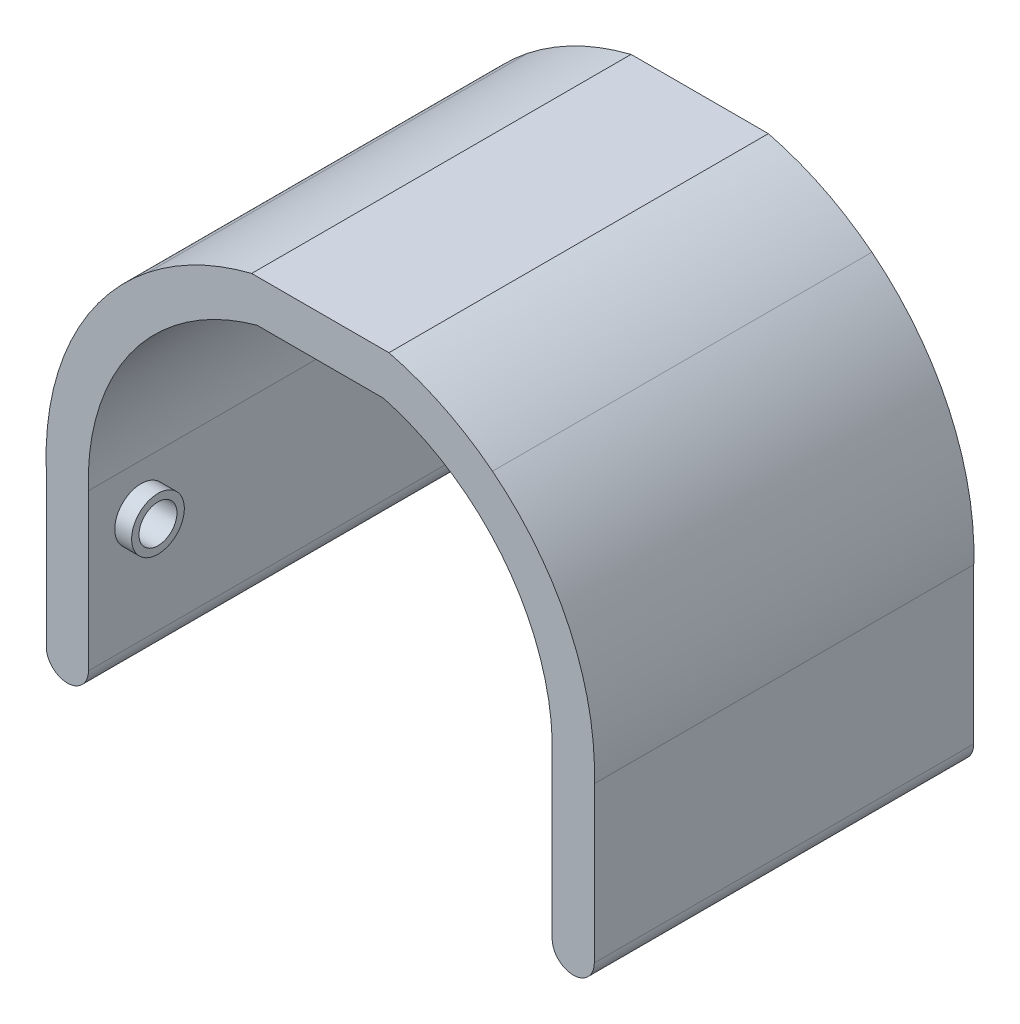
from build123d import *

# Parameters (mm, degrees)
SKETCH1_W                           = 50
SKETCH1_H                           = 50
BOSS_EXTRUDE1_DEPTH                 = 60
CUT_EXTRUDE1_DEPTH                  = 60
CUT_EXTRUDE2_START                  = -60
CUT_EXTRUDE2_DEPTH                  = 60
SKETCH5_OUTSIDE_W                   = 70.548
SKETCH5_OUTSIDE_H                   = 70.548
CUT_EXTRUDE3_DEPTH                  = 10
CUT_EXTRUDE4_DEPTH                  = 10
FILLET1_R                           = 1
SKETCH7_R                           = 2
BOSS_EXTRUDE2_DEPTH                 = 2
BOSS_EXTRUDE3_START                 = 2
SKETCH8_R                           = 2
BOSS_EXTRUDE3_DEPTH                 = 2
SKETCH9_R                           = 2.25
CUT_EXTRUDE5_DEPTH                  = 2
CUT_EXTRUDE6_START                  = -2
SKETCH10_R                          = 2.25
CUT_EXTRUDE6_DEPTH                  = 2
FILLET2_R                           = 1
CUT_EXTRUDE7_REACH                  = 71.642
CUT_EXTRUDE7_END_RADIUS             = 25
CUT_EXTRUDE7_DIRECTION_2_REACH      = 71.642
CUT_EXTRUDE7_DIRECTION_2_END_RADIUS = 25
BOSS_EXTRUDE4_DEPTH                 = 35
BOSS_EXTRUDE4_DEPTH_BACK            = 10
SKETCH14_R                          = 2
BOSS_EXTRUDE5_DEPTH                 = 0.1
SKETCH15_R                          = 3
SKETCH15_R_2                        = 2.25
BOSS_EXTRUDE6_DEPTH                 = 7
SKETCH16_R                          = 2.25
CUT_EXTRUDE8_DEPTH                  = 2
SKETCH17_W                          = 10
SKETCH17_H                          = 10
CUT_EXTRUDE9_DEPTH                  = 29.758852585
SKETCH18_W                          = 10
SKETCH18_H                          = 14.003619208
CUT_EXTRUDE10_DEPTH                 = 31.758852585
SKETCH20_R                          = 3
SKETCH20_R_2                        = 2.25
BOSS_EXTRUDE8_DEPTH                 = 7
SKETCH21_R                          = 2.25
CUT_EXTRUDE11_DEPTH                 = 4
CUT_EXTRUDE12_DEPTH                 = 40
SKETCH23_R                          = 2.25
CUT_EXTRUDE13_DEPTH                 = 4
SKETCH24_R                          = 2.25
CUT_EXTRUDE14_DEPTH                 = 2
SKETCH25_R                          = 3.125
SKETCH25_R_2                        = 2.25
BOSS_EXTRUDE9_DEPTH                 = 7
SKETCH26_R                          = 2.25
CUT_EXTRUDE15_DEPTH                 = 4


# Read off the part's stored shape, not the designer's step: Cut-Extrude2
with BuildPart() as part:
    # Sketch1 → Boss-Extrude1 (new body)
    with BuildSketch(Plane.XY):
        Rectangle(SKETCH1_W, SKETCH1_H)
    extrude(amount=BOSS_EXTRUDE1_DEPTH)

    # Sketch3 → Cut-Extrude1 (cut)
    with BuildSketch(Plane.XY.offset(60)):
        with BuildLine():
            Line((-25, 25), (-25, 0))
            ThreePointArc((-25, 0), (-17.677669541, 17.677669518), (-3.2e-08, 25))
            Line((-3.2e-08, 25), (-25, 25))
        make_face()
        with BuildLine():
            Line((25, 25), (-3.2e-08, 25))
            ThreePointArc((-3.2e-08, 25), (17.677669518, 17.677669541), (25, 0))
            Line((25, 0), (25, 25))
        make_face()
    extrude(amount=-CUT_EXTRUDE1_DEPTH, mode=Mode.SUBTRACT)

    # Cut-Extrude2 outline → Cut-Extrude2 (cut)
    with BuildSketch(Plane.XY.offset(60).offset(CUT_EXTRUDE2_START)):
        with BuildLine():
            ThreePointArc((8.576916353, -23.025834486), (10.616475204, -9.420494413), (7.92577262, 4.071177033))
            ThreePointArc((7.92577262, 4.071177033), (0, 9.5), (-7.92577262, 4.071177033))
            ThreePointArc((-7.92577262, 4.071177033), (-10.616475204, -9.420494413), (-8.576916353, -23.025834486))
            ThreePointArc((-8.576916353, -23.025834486), (-8.783191003, -24.377140732), (-10, -25))
            Line((-10, -25), (10, -25))
            ThreePointArc((10, -25), (8.783191003, -24.377140732), (8.576916353, -23.025834486))
        make_face()
        with BuildLine():
            ThreePointArc((25, -11.035759956), (21.246950766, -20.57515197), (12, -25))
            Line((12, -25), (25, -25))
            Line((25, -25), (25, -11.035759956))
        make_face()
        with BuildLine():
            Line((-25, -25), (-12, -25))
            ThreePointArc((-12, -25), (-21.246950766, -20.57515197), (-25, -11.035759956))
            Line((-25, -11.035759956), (-25, -25))
        make_face()
    extrude(amount=CUT_EXTRUDE2_DEPTH, mode=Mode.SUBTRACT)

    # Sketch5 outside → Cut-Extrude3 (cut)
    with BuildSketch(Plane.XY.offset(60)):
        Rectangle(SKETCH5_OUTSIDE_W, SKETCH5_OUTSIDE_H)
        with BuildLine():
            Line((-7.92577262, 4.071177033), (-12.879426293, 4.071177033))
            Line((-12.879426293, 4.071177033), (-12.879426293, -5.928822967))
            Line((-12.879426293, -5.928822967), (-10.379426293, -5.928822967))
            ThreePointArc((-10.379426293, -5.928822967), (-9.475712618, -0.849542187), (-7.92577262, 4.071177033))
        make_face(mode=Mode.SUBTRACT)
        with BuildLine():
            Line((7.92577262, 4.071177033), (12.879426293, 4.071177033))
            Line((12.879426293, 4.071177033), (12.879426293, -5.928822967))
            Line((12.879426293, -5.928822967), (10.379426293, -5.928822967))
            ThreePointArc((10.379426293, -5.928822967), (9.475712618, -0.849542187), (7.92577262, 4.071177033))
        make_face(mode=Mode.SUBTRACT)
    extrude(amount=-CUT_EXTRUDE3_DEPTH, mode=Mode.SUBTRACT)

    # Sketch6 → Cut-Extrude4 (cut)
    # profile 1 of 4: a face of its own
    with BuildSketch(Plane(origin=(0, 0, 0), x_dir=(-1, 0, 0), z_dir=(0, 0, -1))):
        with BuildLine():
            Line((0, 9.5), (0, 25))
            ThreePointArc((0, 25), (-17.67766953, 17.67766953), (-25, 0))
            Line((-25, 0), (-25, -11.035759956))
            ThreePointArc((-25, -11.035759956), (-21.246950766, -20.57515197), (-12, -25))
            Line((-12, -25), (-10, -25))
            ThreePointArc((-10, -25), (-8.783191003, -24.377140732), (-8.576916353, -23.025834486))
            ThreePointArc((-8.576916353, -23.025834486), (-10.289550459, -15.574005024), (-10.552980025, -7.932442175))
            ThreePointArc((-10.552980025, -7.932442175), (-10.478797406, -6.929541656), (-10.379426293, -5.928822967))
            ThreePointArc((-10.379426293, -5.928822967), (-9.475712618, -0.849542187), (-7.92577262, 4.071177033))
            ThreePointArc((-7.92577262, 4.071177033), (-4.803383975, 8.012667281), (0, 9.5))
        make_face()
        with BuildLine():
            Line((-12.879426293, 6.071177033), (-12.879426293, 3.071177033))
            Line((-12.879426293, 3.071177033), (-12.879426293, -4.928822967))
            Line((-12.879426293, -4.928822967), (-12.879426293, -7.932442175))
            Line((-12.879426293, -7.932442175), (-14.879423018, -7.932442175))
            ThreePointArc((-14.879423018, -7.932442175), (-15.586532115, -7.639547997), (-15.879426293, -6.932438901))
            Line((-15.879426293, -6.932438901), (-15.879426293, 5.071173759))
            ThreePointArc((-15.879426293, 5.071173759), (-15.586532115, 5.778282855), (-14.879423018, 6.071177033))
            Line((-14.879423018, 6.071177033), (-12.879426293, 6.071177033))
        make_face(mode=Mode.SUBTRACT)
    # profile 2 of 4: a face of its own
    with BuildSketch(Plane(origin=(0, 0, 0), x_dir=(-1, 0, 0), z_dir=(0, 0, -1))):
        with BuildLine():
            ThreePointArc((25, 0), (17.67766953, 17.67766953), (0, 25))
            Line((0, 25), (0, 9.5))
            ThreePointArc((0, 9.5), (4.803383975, 8.012667281), (7.92577262, 4.071177033))
            ThreePointArc((7.92577262, 4.071177033), (10.616475204, -9.420494413), (8.576916353, -23.025834486))
            ThreePointArc((8.576916353, -23.025834486), (8.783191003, -24.377140732), (10, -25))
            Line((10, -25), (12, -25))
            ThreePointArc((12, -25), (21.246950766, -20.57515197), (25, -11.035759956))
            Line((25, -11.035759956), (25, 0))
        make_face()
        with BuildLine():
            Line((12.879426293, -4.928822967), (12.879426293, 3.071177033))
            Line((12.879426293, 3.071177033), (12.879426293, 6.071177033))
            Line((12.879426293, 6.071177033), (14.879423018, 6.071177033))
            ThreePointArc((14.879423018, 6.071177033), (15.586532115, 5.778282855), (15.879426293, 5.071173759))
            Line((15.879426293, 5.071173759), (15.879426293, -6.932438901))
            ThreePointArc((15.879426293, -6.932438901), (15.586532115, -7.639547997), (14.879423018, -7.932442175))
            Line((14.879423018, -7.932442175), (12.879426293, -7.932442175))
            Line((12.879426293, -7.932442175), (12.879426293, -4.928822967))
        make_face(mode=Mode.SUBTRACT)
    # profile 3 of 4: a face of its own
    with BuildSketch(Plane(origin=(0, 0, 0), x_dir=(-1, 0, 0), z_dir=(0, 0, -1))):
        with BuildLine():
            Line((0, 9.5), (0, 25))
            ThreePointArc((0, 25), (-17.67766953, 17.67766953), (-25, 0))
            Line((-25, 0), (-25, -11.035759956))
            ThreePointArc((-25, -11.035759956), (-21.246950766, -20.57515197), (-12, -25))
            Line((-12, -25), (-10, -25))
            ThreePointArc((-10, -25), (-8.783191003, -24.377140732), (-8.576916353, -23.025834486))
            ThreePointArc((-8.576916353, -23.025834486), (-10.289550459, -15.574005024), (-10.552980025, -7.932442175))
            ThreePointArc((-10.552980025, -7.932442175), (-10.478797406, -6.929541656), (-10.379426293, -5.928822967))
            ThreePointArc((-10.379426293, -5.928822967), (-9.475712618, -0.849542187), (-7.92577262, 4.071177033))
            ThreePointArc((-7.92577262, 4.071177033), (-4.803383975, 8.012667281), (0, 9.5))
        make_face()
        with BuildLine():
            Line((-12.879426293, 6.071177033), (-12.879426293, 3.071177033))
            Line((-12.879426293, 3.071177033), (-12.879426293, -4.928822967))
            Line((-12.879426293, -4.928822967), (-12.879426293, -7.932442175))
            Line((-12.879426293, -7.932442175), (-14.879423018, -7.932442175))
            ThreePointArc((-14.879423018, -7.932442175), (-15.586532115, -7.639547997), (-15.879426293, -6.932438901))
            Line((-15.879426293, -6.932438901), (-15.879426293, 5.071173759))
            ThreePointArc((-15.879426293, 5.071173759), (-15.586532115, 5.778282855), (-14.879423018, 6.071177033))
            Line((-14.879423018, 6.071177033), (-12.879426293, 6.071177033))
        make_face(mode=Mode.SUBTRACT)
    # profile 4 of 4: a face of its own
    with BuildSketch(Plane(origin=(0, 0, 0), x_dir=(-1, 0, 0), z_dir=(0, 0, -1))):
        with BuildLine():
            ThreePointArc((25, 0), (17.67766953, 17.67766953), (0, 25))
            Line((0, 25), (0, 9.5))
            ThreePointArc((0, 9.5), (4.803383975, 8.012667281), (7.92577262, 4.071177033))
            ThreePointArc((7.92577262, 4.071177033), (10.616475204, -9.420494413), (8.576916353, -23.025834486))
            ThreePointArc((8.576916353, -23.025834486), (8.783191003, -24.377140732), (10, -25))
            Line((10, -25), (12, -25))
            ThreePointArc((12, -25), (21.246950766, -20.57515197), (25, -11.035759956))
            Line((25, -11.035759956), (25, 0))
        make_face()
        with BuildLine():
            Line((12.879426293, -4.928822967), (12.879426293, 3.071177033))
            Line((12.879426293, 3.071177033), (12.879426293, 6.071177033))
            Line((12.879426293, 6.071177033), (14.879423018, 6.071177033))
            ThreePointArc((14.879423018, 6.071177033), (15.586532115, 5.778282855), (15.879426293, 5.071173759))
            Line((15.879426293, 5.071173759), (15.879426293, -6.932438901))
            ThreePointArc((15.879426293, -6.932438901), (15.586532115, -7.639547997), (14.879423018, -7.932442175))
            Line((14.879423018, -7.932442175), (12.879426293, -7.932442175))
            Line((12.879426293, -7.932442175), (12.879426293, -4.928822967))
        make_face(mode=Mode.SUBTRACT)
    extrude(amount=-CUT_EXTRUDE4_DEPTH, mode=Mode.SUBTRACT)

    # Fillet1
    fillet1_edges = [part.edges().sort_by_distance(p)[0] for p in [
        (12.879426293, 4.071177033, 55),
        (12.879426293, -5.928822967, 55),
        (-12.879426293, -5.928822967, 55),
        (-12.879426293, 4.071177033, 55),
    ]]
    fillet(fillet1_edges, radius=FILLET1_R)

    # Sketch7 → Boss-Extrude2 (add)
    with BuildSketch(Plane.ZY.offset(12.879426293)):
        with Locations(Location((55, -0.928822967, 0), (0, 0, 270))):
            Circle(SKETCH7_R)
    extrude(amount=BOSS_EXTRUDE2_DEPTH)

    # Sketch8 → Boss-Extrude3 (add)
    with BuildSketch(Plane(origin=(12.879426293, 0, 0), x_dir=(0, 0, -1), z_dir=(1, 0, 0)).offset(BOSS_EXTRUDE3_START)):
        with Locations(Location((-55, -0.928822967, 0), (0, 0, 270))):
            Circle(SKETCH8_R)
    extrude(amount=-BOSS_EXTRUDE3_DEPTH)

    # Sketch9 → Cut-Extrude5 (cut)
    with BuildSketch(Plane.ZY.offset(-12.879426293)):
        with Locations(Location((5, -0.930632571, 0), (0, 0, 270))):
            Circle(SKETCH9_R)
    extrude(amount=-CUT_EXTRUDE5_DEPTH, mode=Mode.SUBTRACT)

    # Sketch10 → Cut-Extrude6 (cut)
    with BuildSketch(Plane(origin=(-12.879426293, 0, 0), x_dir=(0, 0, -1), z_dir=(1, 0, 0)).offset(CUT_EXTRUDE6_START)):
        with Locations(Location((-5, -0.930632571, 0), (0, 0, 270))):
            Circle(SKETCH10_R)
    extrude(amount=CUT_EXTRUDE6_DEPTH, mode=Mode.SUBTRACT)

    # Fillet2
    fillet2_edges = [part.edges().sort_by_distance(p)[0] for p in [
        (-12.879426293, 6.071177033, 5),
        (-12.879426293, -7.932442175, 5),
        (12.879426293, -7.932442175, 5),
        (12.879426293, 6.071177033, 5),
    ]]
    fillet(fillet2_edges, radius=FILLET2_R)

    # Cut-Extrude7: up to this cylinder (the profile starts inside it)
    cut_extrude7_end = Plane(origin=(0, 0, 27.7442175), z_dir=(0, 0, 1)) * Cylinder(CUT_EXTRUDE7_END_RADIUS, 227.198087, mode=Mode.PRIVATE)
    # Sketch11 → Cut-Extrude7 (cut, up to the surface)
    with BuildSketch(Plane(origin=(0, 0, 0), x_dir=(0, 0, -1), z_dir=(1, 0, 0)), mode=Mode.PRIVATE) as cut_extrude7_sk1:
        with BuildLine():
            add(Edge.make_bspline(
                [(-50, 12.5), (-45.835040113, 20.240050977), (-37.917520056, 24.110076465), (-30, 24.110076465)],
                knots=[0, 0, 0, 0, 0.5, 0.5, 0.5, 0.5], degree=3))
            Line((-30, 24.110076465), (-30, 25))
            Line((-30, 25), (-50, 25))
            Line((-50, 25), (-50, 12.5))
        make_face()
    cut_extrude7_tool1 = extrude(cut_extrude7_sk1.sketch, amount=CUT_EXTRUDE7_REACH, mode=Mode.PRIVATE) & cut_extrude7_end
    add(cut_extrude7_tool1.solids().sort_by_distance((0, 21.671006, 44.201261))[0], mode=Mode.SUBTRACT)
    # Sketch11 → Cut-Extrude7 (cut, up to the surface)
    with BuildSketch(Plane(origin=(0, 0, 0), x_dir=(0, 0, -1), z_dir=(1, 0, 0)), mode=Mode.PRIVATE) as cut_extrude7_sk2:
        with BuildLine():
            add(Edge.make_bspline(
                [(-30, 24.110076465), (-22.082479944, 24.110076465), (-14.164959887, 20.240050977), (-10, 12.5)],
                knots=[0.5, 0.5, 0.5, 0.5, 1, 1, 1, 1], degree=3))
            ThreePointArc((-10, 12.5), (-11.128726859, 19.123824427), (-14.387505004, 25))
            Line((-14.387505004, 25), (-30, 25))
            Line((-30, 25), (-30, 24.110076465))
        make_face()
    cut_extrude7_tool2 = extrude(cut_extrude7_sk2.sketch, amount=CUT_EXTRUDE7_REACH, mode=Mode.PRIVATE) & cut_extrude7_end
    add(cut_extrude7_tool2.solids().sort_by_distance((0, 21.59828, 16.984521))[0], mode=Mode.SUBTRACT)
    # Sketch11 → Cut-Extrude7 (cut, up to the surface)
    with BuildSketch(Plane(origin=(0, 0, 0), x_dir=(0, 0, -1), z_dir=(1, 0, 0)), mode=Mode.PRIVATE) as cut_extrude7_sk3:
        with BuildLine():
            ThreePointArc((-14.387505004, 25), (-11.128726859, 19.123824427), (-10, 12.5))
            Line((-10, 12.5), (-10, 25))
            Line((-10, 25), (-14.387505004, 25))
        make_face()
    cut_extrude7_tool3 = extrude(cut_extrude7_sk3.sketch, amount=CUT_EXTRUDE7_REACH, mode=Mode.PRIVATE) & cut_extrude7_end
    add(cut_extrude7_tool3.solids().sort_by_distance((0, 21.947708, 11.287174))[0], mode=Mode.SUBTRACT)

    # Cut-Extrude7 direction 2: up to this cylinder (the profile starts inside it)
    cut_extrude7_direction_2_end = Plane(origin=(0, 0, 27.7442175), z_dir=(0, 0, 1)) * Cylinder(CUT_EXTRUDE7_DIRECTION_2_END_RADIUS, 227.198087, mode=Mode.PRIVATE)
    # Sketch11 → Cut-Extrude7 direction 2 (cut, up to the surface)
    with BuildSketch(Plane(origin=(0, 0, 0), x_dir=(0, 0, -1), z_dir=(1, 0, 0)), mode=Mode.PRIVATE) as cut_extrude7_direction_2_sk1:
        with BuildLine():
            add(Edge.make_bspline(
                [(-50, 12.5), (-45.835040113, 20.240050977), (-37.917520056, 24.110076465), (-30, 24.110076465)],
                knots=[0, 0, 0, 0, 0.5, 0.5, 0.5, 0.5], degree=3))
            Line((-30, 24.110076465), (-30, 25))
            Line((-30, 25), (-50, 25))
            Line((-50, 25), (-50, 12.5))
        make_face()
    cut_extrude7_direction_2_tool1 = extrude(cut_extrude7_direction_2_sk1.sketch, amount=-CUT_EXTRUDE7_DIRECTION_2_REACH, mode=Mode.PRIVATE) & cut_extrude7_direction_2_end
    add(cut_extrude7_direction_2_tool1.solids().sort_by_distance((0, 21.671006, 44.201261))[0], mode=Mode.SUBTRACT)
    # Sketch11 → Cut-Extrude7 direction 2 (cut, up to the surface)
    with BuildSketch(Plane(origin=(0, 0, 0), x_dir=(0, 0, -1), z_dir=(1, 0, 0)), mode=Mode.PRIVATE) as cut_extrude7_direction_2_sk2:
        with BuildLine():
            add(Edge.make_bspline(
                [(-30, 24.110076465), (-22.082479944, 24.110076465), (-14.164959887, 20.240050977), (-10, 12.5)],
                knots=[0.5, 0.5, 0.5, 0.5, 1, 1, 1, 1], degree=3))
            ThreePointArc((-10, 12.5), (-11.128726859, 19.123824427), (-14.387505004, 25))
            Line((-14.387505004, 25), (-30, 25))
            Line((-30, 25), (-30, 24.110076465))
        make_face()
    cut_extrude7_direction_2_tool2 = extrude(cut_extrude7_direction_2_sk2.sketch, amount=-CUT_EXTRUDE7_DIRECTION_2_REACH, mode=Mode.PRIVATE) & cut_extrude7_direction_2_end
    add(cut_extrude7_direction_2_tool2.solids().sort_by_distance((0, 21.59828, 16.984521))[0], mode=Mode.SUBTRACT)
    # Sketch11 → Cut-Extrude7 direction 2 (cut, up to the surface)
    with BuildSketch(Plane(origin=(0, 0, 0), x_dir=(0, 0, -1), z_dir=(1, 0, 0)), mode=Mode.PRIVATE) as cut_extrude7_direction_2_sk3:
        with BuildLine():
            ThreePointArc((-14.387505004, 25), (-11.128726859, 19.123824427), (-10, 12.5))
            Line((-10, 12.5), (-10, 25))
            Line((-10, 25), (-14.387505004, 25))
        make_face()
    cut_extrude7_direction_2_tool3 = extrude(cut_extrude7_direction_2_sk3.sketch, amount=-CUT_EXTRUDE7_DIRECTION_2_REACH, mode=Mode.PRIVATE) & cut_extrude7_direction_2_end
    add(cut_extrude7_direction_2_tool3.solids().sort_by_distance((0, 21.947708, 11.287174))[0], mode=Mode.SUBTRACT)

    # Sketch14 → Boss-Extrude5 (add)
    with BuildSketch(Plane.ZY.offset(25)):
        with Locations(Location((46.25, -5.517879978, 0), (0, 0, 180))):
            Circle(SKETCH14_R)
    extrude(amount=BOSS_EXTRUDE5_DEPTH)

    # Sketch17 → Cut-Extrude9 (cut)
    with BuildSketch(Plane.ZY.offset(14.879426293)):
        with Locations((55, -0.928822967)):
            Rectangle(SKETCH17_W, SKETCH17_H)
    extrude(amount=-CUT_EXTRUDE9_DEPTH, mode=Mode.SUBTRACT)

    # Sketch18 → Cut-Extrude10 (cut)
    with BuildSketch(Plane.ZY.offset(15.879426293)):
        with Locations((5, -0.930632571)):
            Rectangle(SKETCH18_W, SKETCH18_H)
    extrude(amount=-CUT_EXTRUDE10_DEPTH, mode=Mode.SUBTRACT)

    # Sketch22 → Cut-Extrude12 (cut)
    with BuildSketch(Plane(origin=(0, 0, 10), x_dir=(-1, 0, 0), z_dir=(0, 0, -1))):
        with BuildLine():
            ThreePointArc((13.927271842, 22.269557575), (22.703581778, 12.718484283), (25.250496515, 0))
            Line((25.250496515, 0), (25.250496515, -10.329981393))
            Line((25.250496515, -10.329981393), (25.250496515, -25.890161066))
            Line((25.250496515, -25.890161066), (-25, -25.890161066))
            Line((-25, -25.890161066), (-25, -11.035759956))
            ThreePointArc((-25, -11.035759956), (-21.246950766, -20.57515197), (-12, -25))
            Line((-12, -25), (-10, -25))
            ThreePointArc((-10, -25), (-8.783191003, -24.377140732), (-8.576916353, -23.025834486))
            ThreePointArc((-8.576916353, -23.025834486), (-10.616475204, -9.420494413), (-7.92577262, 4.071177033))
            ThreePointArc((-7.92577262, 4.071177033), (0, 9.5), (7.92577262, 4.071177033))
            ThreePointArc((7.92577262, 4.071177033), (10.616475204, -9.420494413), (8.576916353, -23.025834486))
            ThreePointArc((8.576916353, -23.025834486), (8.783191003, -24.377140732), (10, -25))
            Line((10, -25), (12, -25))
            ThreePointArc((12, -25), (21.246950766, -20.57515197), (25, -11.035759956))
            Line((25, -11.035759956), (25, 0))
            ThreePointArc((25, 0), (24.148145657, 6.470476128), (21.650635095, 12.5))
            Line((21.650635095, 12.5), (-21.650635095, 12.5))
            ThreePointArc((-21.650635095, 12.5), (-24.148145657, 6.470476128), (-25, 0))
            Line((-25, 0), (-25, 10.56531366))
            ThreePointArc((-25, 10.56531366), (-8.174232985, 25.190752437), (13.927271842, 22.269557575))
        make_face()
        with BuildLine():
            ThreePointArc((-10, -25), (-8.783191003, -24.377140732), (-8.576916353, -23.025834486))
            ThreePointArc((-8.576916353, -23.025834486), (-10.616475204, -9.420494413), (-7.92577262, 4.071177033))
            ThreePointArc((-7.92577262, 4.071177033), (0, 9.5), (7.92577262, 4.071177033))
            ThreePointArc((7.92577262, 4.071177033), (10.616475204, -9.420494413), (8.576916353, -23.025834486))
            ThreePointArc((8.576916353, -23.025834486), (8.783191003, -24.377140732), (10, -25))
            Line((10, -25), (12, -25))
            ThreePointArc((12, -25), (21.246950766, -20.57515197), (25, -11.035759956))
            Line((25, -11.035759956), (25, 0))
            ThreePointArc((25, 0), (24.148145657, 6.470476128), (21.650635095, 12.5))
            Line((21.650635095, 12.5), (-21.650635095, 12.5))
            ThreePointArc((-21.650635095, 12.5), (-24.148145657, 6.470476128), (-25, 0))
            Line((-25, 0), (-25, -11.035759956))
            ThreePointArc((-25, -11.035759956), (-21.246950766, -20.57515197), (-12, -25))
            Line((-12, -25), (-10, -25))
        make_face()
    extrude(amount=-CUT_EXTRUDE12_DEPTH, mode=Mode.SUBTRACT)


with BuildPart() as body_2:
    # Sketch13 → Boss-Extrude4 (new, two sides: drawn at the far end of the back side and taken through both)
    with BuildSketch(Plane.XY.offset(50).offset(-BOSS_EXTRUDE4_DEPTH_BACK)):
        with BuildLine():
            Line((-27.5, 0), (-27.5, -18.5))
            ThreePointArc((-27.5, -18.5), (-30, -21), (-32.5, -18.5))
            Line((-32.5, -18.5), (-32.5, -0.08926685))
            ThreePointArc((-32.5, -0.08926685), (-29.569098843, 14.379149235), (-20.424111586, 25.96769762))
            ThreePointArc((-20.424111586, 25.96769762), (-14.603149144, 29.637766733), (-8.139956045, 32))
            Line((-8.139956045, 32), (8.139956045, 32))
            ThreePointArc((8.139956045, 32), (14.603149144, 29.637766733), (20.424111586, 25.96769762))
            ThreePointArc((20.424111586, 25.96769762), (29.569098843, 14.379149235), (32.5, -0.08926685))
            Line((32.5, -0.08926685), (32.5, -18.5))
            ThreePointArc((32.5, -18.5), (30, -21), (27.5, -18.5))
            Line((27.5, -18.5), (27.5, 0))
            ThreePointArc((27.5, 0), (25.04979452, 12.239551007), (17.324653965, 22.044260038))
            ThreePointArc((17.324653965, 22.044260038), (12.662730485, 25.018549885), (7.5, 27))
            Line((7.5, 27), (-7.5, 27))
            ThreePointArc((-7.5, 27), (-12.662730485, 25.018549885), (-17.324653965, 22.044260038))
            ThreePointArc((-17.324653965, 22.044260038), (-25.04979452, 12.239551007), (-27.5, 0))
        make_face()
    extrude(amount=BOSS_EXTRUDE4_DEPTH + BOSS_EXTRUDE4_DEPTH_BACK)

    # Sketch15 → Boss-Extrude6 (add)
    with BuildSketch(Plane.ZY.offset(32.5)):
        with Locations((46.25, -5.517879978)):
            Circle(SKETCH15_R)
        with Locations((46.25, -5.517879978)):
            Circle(SKETCH15_R_2, mode=Mode.SUBTRACT)
    extrude(amount=-BOSS_EXTRUDE6_DEPTH)

    # Sketch16 → Cut-Extrude8 (cut)
    with BuildSketch(Plane(origin=(-27.5, 0, 0), x_dir=(0, 0, -1), z_dir=(1, 0, 0))):
        with Locations(Location((-46.25, -5.517879978, 0), (0, 0, 180))):
            Circle(SKETCH16_R)
    extrude(amount=-CUT_EXTRUDE8_DEPTH, mode=Mode.SUBTRACT)

    # Sketch20 → Boss-Extrude8 (add)
    # profile 1 of 2: a face of its own
    with BuildSketch(Plane(origin=(32.5, 0, 0), x_dir=(0, 0, -1), z_dir=(1, 0, 0))):
        with Locations(Location((-46.25, -5.517879978, 0), (0, 0, 180))):
            Circle(SKETCH20_R)
        with Locations(Location((-46.25, -5.517879978, 0), (0, 0, 180))):
            Circle(SKETCH20_R_2, mode=Mode.SUBTRACT)
    # profile 2 of 2: a face of its own
    with BuildSketch(Plane(origin=(32.5, 0, 0), x_dir=(0, 0, -1), z_dir=(1, 0, 0))):
        with Locations((-78.75, -5.517879978)):
            Circle(SKETCH20_R)
        with Locations((-78.75, -5.517879978)):
            Circle(SKETCH20_R_2, mode=Mode.SUBTRACT)
    extrude(amount=-BOSS_EXTRUDE8_DEPTH)

    # Sketch21 → Cut-Extrude11 (cut)
    with BuildSketch(Plane.ZY.offset(-27.5)):
        with Locations((46.25, -5.517879978)):
            Circle(SKETCH21_R)
    extrude(amount=-CUT_EXTRUDE11_DEPTH, mode=Mode.SUBTRACT)

    # Sketch23 → Cut-Extrude13 (cut)
    with BuildSketch(Plane.ZY.offset(-27.5)):
        with Locations(Location((78.75, -5.517879978, 0), (0, 0, 180))):
            Circle(SKETCH23_R)
    extrude(amount=-CUT_EXTRUDE13_DEPTH, mode=Mode.SUBTRACT)

    # Sketch24 → Cut-Extrude14 (cut)
    with BuildSketch(Plane(origin=(-29.5, 0, 0), x_dir=(0, 0, -1), z_dir=(1, 0, 0))):
        with Locations(Location((-46.25, -5.517879978, 0), (0, 0, 180))):
            Circle(SKETCH24_R)
    extrude(amount=-CUT_EXTRUDE14_DEPTH, mode=Mode.SUBTRACT)

    # Sketch25 → Boss-Extrude9 (add)
    with BuildSketch(Plane.ZY.offset(32.5)):
        with Locations((78.75, -5.51787995)):
            Circle(SKETCH25_R)
        with Locations(Location((78.75, -5.51787995, 0), (0, 0, 180.000000718))):
            Circle(SKETCH25_R_2, mode=Mode.SUBTRACT)
    extrude(amount=-BOSS_EXTRUDE9_DEPTH)

    # Sketch26 → Cut-Extrude15 (cut)
    with BuildSketch(Plane(origin=(-27.5, 0, 0), x_dir=(0, 0, -1), z_dir=(1, 0, 0))):
        with Locations(Location((-78.75, -5.51787995, 0), (0, 0, 359.999999282))):
            Circle(SKETCH26_R)
    extrude(amount=-CUT_EXTRUDE15_DEPTH, mode=Mode.SUBTRACT)


solid = body_2.part
